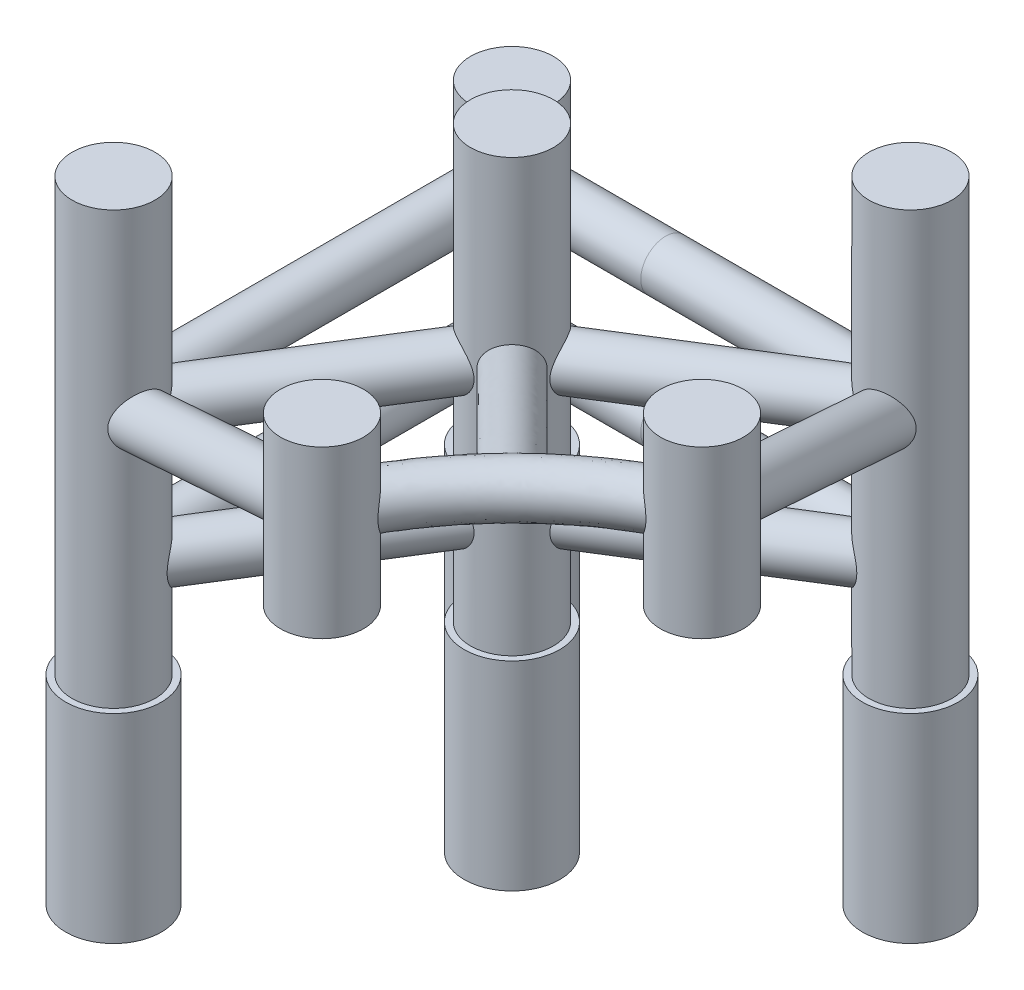
from build123d import *
from build123d.topology import SkipClean

# Parameters (mm, degrees)
SKETCH2_R             = 4.572
BOSS_EXTRUDE1_DEPTH   = 19.05
BOSS_EXTRUDE1_2_DEPTH = 19.05
BOSS_EXTRUDE1_3_DEPTH = 19.05
BOSS_EXTRUDE1_4_DEPTH = 19.05
SKETCH3_R             = 3.96875
BOSS_EXTRUDE2_DEPTH   = 41.275
SKETCH5_R             = 2.38125
CUT_EXTRUDE1_START    = -11.1125
SKETCH6_R             = 3.96875
CUT_EXTRUDE1_DEPTH    = 11.1125
CUT_EXTRUDE2_DEPTH    = 61.90888739
SKETCH11_R            = 2.38125
BOSS_EXTRUDE3_REACH   = 57.171
SKETCH12_R            = 3.96875
SKETCH13_R            = 3.96875
CUT_EXTRUDE3_DEPTH    = 6.35
SKETCH15_R            = 2.38125
SKETCH17_R            = 2.38125
SKETCH20_R            = 2.38125


with BuildPart() as part:
    # Sketch2 → Boss-Extrude1 (new body)
    with BuildSketch(Plane(origin=(0, 0, 0), x_dir=(1, 0, 0), z_dir=(0, 1, 0))):
        with Locations(Location((-14.697037733, 14.697037733, 0), (0, 0, 270))):
            Circle(SKETCH2_R)
    extrude(amount=-BOSS_EXTRUDE1_DEPTH)



with BuildPart() as body_2:
    # Sketch2 → Boss-Extrude1 2 (new body)
    with BuildSketch(Plane(origin=(0, 0, 0), x_dir=(1, 0, 0), z_dir=(0, 1, 0))):
        with Locations(Location((23.402962267, 14.697037733, 0), (0, 0, 270))):
            Circle(SKETCH2_R)
    extrude(amount=-BOSS_EXTRUDE1_2_DEPTH)


with BuildPart() as body_3:
    # Sketch2 → Boss-Extrude1 3 (new body)
    with BuildSketch(Plane(origin=(0, 0, 0), x_dir=(1, 0, 0), z_dir=(0, 1, 0))):
        with Locations(Location((0, 0, 0), (0, 0, 270))):
            Circle(SKETCH2_R)
    extrude(amount=-BOSS_EXTRUDE1_3_DEPTH)


with BuildPart() as body_4:
    # Sketch2 → Boss-Extrude1 4 (new body)
    with BuildSketch(Plane(origin=(0, 0, 0), x_dir=(1, 0, 0), z_dir=(0, 1, 0))):
        with Locations(Location((-14.697037733, -23.402962267, 0), (0, 0, 270))):
            Circle(SKETCH2_R)
    extrude(amount=-BOSS_EXTRUDE1_4_DEPTH)


with BuildPart() as part_1:
    add(part.part)

    add(body_2.part)  # Boss-Extrude2 merges body 2

    add(body_3.part)  # Boss-Extrude2 merges body 3

    add(body_4.part)  # Boss-Extrude2 merges body 4
    # Sketch3 → Boss-Extrude2 (add)
    with BuildSketch(Plane(origin=(0, 0, 0), x_dir=(1, 0, 0), z_dir=(0, 1, 0))):
        with Locations(Location((-14.697037733, 14.697037733, 0), (0, 0, 270))):
            Circle(SKETCH3_R)
        with Locations(Location((23.402962267, 14.697037733, 0), (0, 0, 270))):
            Circle(SKETCH3_R)
        with Locations(Location((0, 0, 0), (0, 0, 270))):
            Circle(SKETCH3_R)
        with Locations(Location((-14.697037733, -23.402962267, 0), (0, 0, 270))):
            Circle(SKETCH3_R)
    extrude(amount=BOSS_EXTRUDE2_DEPTH)

    # Sweep2: sweep along a path in Sketch7
    with BuildLine(Plane(origin=(0, 9.525, 0), x_dir=(1, 0, 0), z_dir=(0, 1, 0))) as sweep2_path:
        Line((-14.697037733, 14.697037733), (23.402962267, 14.697037733))
        Line((23.402962267, 14.697037733), (0, 0))
        Line((0, 0), (-14.697037733, -23.402962267))
        Line((-14.697037733, -23.402962267), (-14.697037733, 14.697037733))
    # Sketch5 → Sweep2 (sweep)
    with BuildSketch(Plane(origin=(0, 0, -9.335158902), x_dir=(0, 0, -1), z_dir=(1, 0, 0))):
        with Locations((5.361878831, 9.525)):
            Circle(SKETCH5_R)
    sweep2 = sweep(path=sweep2_path.line, transition=Transition.RIGHT)

    # Sketch6 → Cut-Extrude1 (cut)
    with BuildSketch(Plane(origin=(0, 41.275, 0), x_dir=(1, 0, 0), z_dir=(0, 1, 0)).offset(CUT_EXTRUDE1_START)):
        with Locations(Location((-14.697037733, 14.697037733, 0), (0, 0, 270))):
            Circle(SKETCH6_R)
    extrude(amount=CUT_EXTRUDE1_DEPTH, mode=Mode.SUBTRACT)

    # Mirror1: Sweep2 across plane
    add(sweep2.mirror(Plane.ZX.offset(15.875)))

    # Sketch8 → Cut-Extrude2 (cut, through all)
    with SkipClean():  # the faces are left unmerged after this step: merging them gives an invalid solid
        with BuildSketch(Plane(origin=(0, 0, 0), x_dir=(1, 0, 0), z_dir=(0, 1, 0))):
            with BuildLine():
                Line((-18.665787733, -23.402962267), (-19.269037733, -23.402962267))
                Line((-19.269037733, -23.402962267), (-24.222037733, -23.402962267))
                ThreePointArc((-24.222037733, -23.402962267), (-14.697037733, -32.927962267), (-5.172037733, -23.402962267))
                Line((-5.172037733, -23.402962267), (-10.125037733, -23.402962267))
                Line((-10.125037733, -23.402962267), (-10.728287733, -23.402962267))
                ThreePointArc((-10.728287733, -23.402962267), (-14.697037733, -27.371712267), (-18.665787733, -23.402962267))
            make_face()
            with BuildLine():
                Line((23.402962267, 18.665787733), (23.402962267, 19.269037733))
                Line((23.402962267, 19.269037733), (23.402962267, 24.222037733))
                ThreePointArc((23.402962267, 24.222037733), (32.927962267, 14.697037733), (23.402962267, 5.172037733))
                Line((23.402962267, 5.172037733), (23.402962267, 10.125037733))
                Line((23.402962267, 10.125037733), (23.402962267, 10.728287733))
                ThreePointArc((23.402962267, 10.728287733), (27.371712267, 14.697037733), (23.402962267, 18.665787733))
            make_face()
        extrude(amount=CUT_EXTRUDE2_DEPTH, mode=Mode.SUBTRACT)
    add(part_1.part.scale(1), mode=Mode.REPLACE)  # the faces are merged on a copy

    # Sweep3: sweep along a path in Sketch10
    with BuildLine(Plane(origin=(-6.256422677, 0, 25.47583107), x_dir=(0.9711434770495425, 0, 0.2384960104155307), z_dir=(-0.2384960104155307, 0, 0.9711434770495425))) as sweep3_path:
        Line((-8.691419193, 22.225), (18.514898404, 30.1625))
        Line((18.514898404, 30.1625), (18.514898404, 38.1))
    # Sketch11 → Sweep3 (sweep)
    with BuildSketch(Plane(origin=(0, 38.1, 0), x_dir=(1, 0, 0), z_dir=(0, 1, 0))):
        with Locations((11.724200137, -29.891560473)):
            Circle(SKETCH11_R)
    sweep3 = sweep(path=sweep3_path.line, transition=Transition.RIGHT)

    # Boss-Extrude3: up to this face of the body (flat: up to its plane)
    boss_extrude3_end = Plane(part_1.part.faces().sort_by_distance((11.724200137, 38.1, 29.891560473))[0])
    # Sketch12 → Boss-Extrude3 (add, up to the picked face)
    with BuildSketch(Plane(origin=(0, 15.875, 0), x_dir=(1, 0, 0), z_dir=(0, 1, 0)), mode=Mode.PRIVATE) as boss_extrude3_sk1:
        with Locations(Location((11.724200137, -29.891560473, 0), (0, 0, 270))):
            Circle(SKETCH12_R)
    boss_extrude3_tool1 = split(extrude(boss_extrude3_sk1.sketch, amount=BOSS_EXTRUDE3_REACH, mode=Mode.PRIVATE), bisect_by=boss_extrude3_end, keep=Keep.BOTH, mode=Mode.PRIVATE)
    boss_extrude3 = boss_extrude3_tool1.solids().sort_by(Axis((11.7242, 15.875, 29.89156), (0, 1, 0)))[0]
    add(boss_extrude3)

    # Sketch13 → Cut-Extrude3 (cut)
    with BuildSketch(Plane.XZ.offset(-15.875)):
        with Locations(Location((11.724200137, 29.891560473, 0), (0, 0, 270))):
            Circle(SKETCH13_R)
    cut_extrude3 = extrude(amount=-CUT_EXTRUDE3_DEPTH, mode=Mode.SUBTRACT)

    # Mirror2: Sweep3, Boss-Extrude3, Cut-Extrude3 across plane
    add(sweep3.mirror(Plane(origin=(0, 0, 0), x_dir=(0.7071067811865483, 0, 0.7071067811865467), z_dir=(0.7071067811865469, 0, -0.7071067811865482))))
    add(boss_extrude3.mirror(Plane(origin=(0, 0, 0), x_dir=(0.7071067811865483, 0, 0.7071067811865467), z_dir=(0.7071067811865469, 0, -0.7071067811865482))))
    add(cut_extrude3.mirror(Plane(origin=(0, 0, 0), x_dir=(0.7071067811865483, 0, 0.7071067811865467), z_dir=(0.7071067811865469, 0, -0.7071067811865482))), mode=Mode.SUBTRACT)

    # Sweep4: sweep along a path in Sketch14
    with BuildLine(Plane(origin=(0, 30.1625, 0), x_dir=(1, 0, 0), z_dir=(0, 1, 0))) as sweep4_path:
        ThreePointArc((29.890402834, -11.71948629), (19.08317303, -19.081952001), (11.724200137, -29.891560473))
    # Sketch15 → Sweep4 (sweep)
    with BuildSketch(Plane(origin=(-6.256422677, 0, 25.47583107), x_dir=(0.9711434770495425, 0, 0.2384960104155307), z_dir=(-0.2384960104155307, 0, 0.9711434770495425))):
        with Locations((18.514898404, 30.1625)):
            Circle(SKETCH15_R)
    sweep(path=sweep4_path.line)

    # Sweep6: sweep along a path in Sketch18
    with BuildLine(Plane(origin=(0, 0, 0), x_dir=(-0.7071067811865482, 0, -0.7071067811865469), z_dir=(0.7071067811865469, 0, -0.7071067811865482))) as sweep6_path:
        Line((0, 22.225), (-26.986818864, 30.1625))
    # Sketch17 → Sweep6 (sweep)
    with BuildSketch(Plane(origin=(0, 15.875, 0), x_dir=(-0.7071067811865469, 0, 0.7071067811865481), z_dir=(-0.7071067811865481, 0, -0.7071067811865469))):
        with Locations((0, 6.35)):
            Circle(SKETCH17_R)
    sweep(path=sweep6_path.line)

    # Sweep7: sweep along a path in Sketch19
    with BuildLine(Plane(origin=(0, 0, 0), x_dir=(-0.7071067811865482, 0, -0.7071067811865469), z_dir=(0.7071067811865469, 0, -0.7071067811865482))) as sweep7_path:
        Line((20.784750088, 9.525), (0, 22.225))
    # Sketch20 → Sweep7 (sweep)
    with BuildSketch(Plane(origin=(0, 15.875, 0), x_dir=(-0.7071067811865469, 0, 0.7071067811865481), z_dir=(-0.7071067811865481, 0, -0.7071067811865469))):
        with Locations((0, 6.35)):
            Circle(SKETCH20_R)
    sweep(path=sweep7_path.line)


solid = part_1.part
